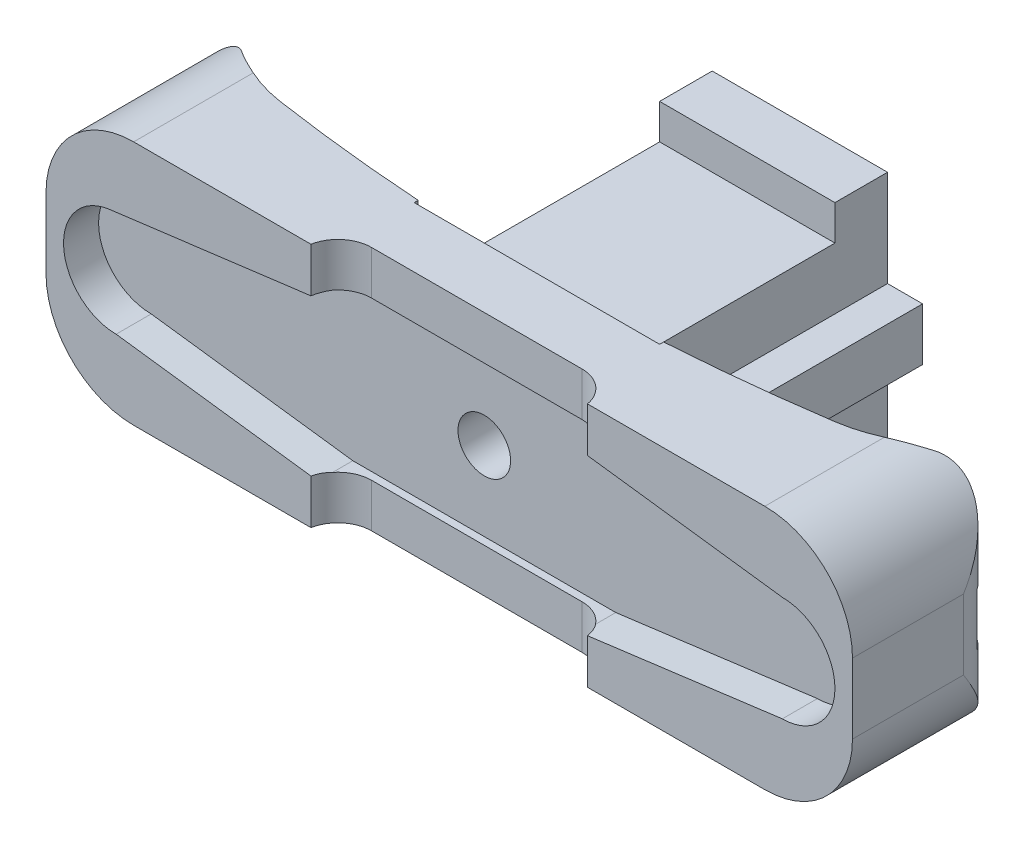
from build123d import *

# Parameters (mm, degrees)
BOSS_EXTRUDE1_DEPTH = 3
BOSS_EXTRUDE2_DEPTH = 2
BOSS_EXTRUDE4_START = 5
BOSS_EXTRUDE4_DEPTH = 5
BOSS_EXTRUDE5_START = -10
BOSS_EXTRUDE5_DEPTH = 10
CUT_EXTRUDE2_DEPTH  = 28.386127875
BOSS_EXTRUDE3_DEPTH = 15
SKETCH9_R           = 1.5
CUT_EXTRUDE3_DEPTH  = 18
SKETCH11_W          = 10
SKETCH11_H          = 3
BOSS_EXTRUDE6_DEPTH = 2
SKETCH12_W          = 6
SKETCH12_H          = 0.35
CUT_EXTRUDE5_DEPTH  = 31.822070135
SKETCH13_R          = 2.25
CUT_EXTRUDE6_DEPTH  = 3
CUT_SWEEP1_START    = -1.5
CUT_SWEEP1_DEPTH    = 3
CUT_EXTRUDE7_DEPTH  = 0.2


# Read off the part's stored shape, not the designer's step: Cut-Sweep1
with BuildPart() as part:
    # Sketch1 → Boss-Extrude1 (new body)
    # profile 1 of 2: a face of its own
    with BuildSketch(Plane.XY):
        with BuildLine():
            Line((7.564942336, -5.5), (19.0695827, -3.999394735))
            ThreePointArc((19.0695827, -3.999394735), (23, 0), (19.0695827, 3.999394735))
            Line((19.0695827, 3.999394735), (7.564942336, 5.5))
            Line((7.564942336, 5.5), (-7.563886473, 5.5))
            Line((-7.563886473, 5.5), (-19.509014255, 3.967480874))
            ThreePointArc((-19.509014255, 3.967480874), (-22.993929187, -0.220294454), (-19.0695827, -3.999394735))
            Line((-19.0695827, -3.999394735), (-7.564942336, -5.5))
            Line((-7.564942336, -5.5), (7.564942336, -5.5))
        make_face()
        with BuildLine():
            Line((-7.5, -4.5), (-19, -3))
            ThreePointArc((-19, -3), (-21.993896455, -0.191269486), (-19.381760691, 2.975610656))
            Line((-19.381760691, 2.975610656), (-7.5, 4.5))
            Line((-7.5, 4.5), (7.5, 4.5))
            Line((7.5, 4.5), (19, 3))
            ThreePointArc((19, 3), (22, 0), (19, -3))
            Line((19, -3), (7.5, -4.5))
            Line((7.5, -4.5), (-7.5, -4.5))
        make_face(mode=Mode.SUBTRACT)
    # profile 2 of 2: a face of its own
    with BuildSketch(Plane.XY):
        with BuildLine():
            ThreePointArc((-19, -3), (-21.993896455, -0.191269486), (-19.381760691, 2.975610656))
            Line((-19.381760691, 2.975610656), (-7.5, 4.5))
            Line((-7.5, 4.5), (7.5, 4.5))
            Line((7.5, 4.5), (19, 3))
            ThreePointArc((19, 3), (22, 0), (19, -3))
            Line((19, -3), (7.5, -4.5))
            Line((7.5, -4.5), (-7.5, -4.5))
            Line((-7.5, -4.5), (-19, -3))
        make_face()
    extrude(amount=BOSS_EXTRUDE1_DEPTH)

    # Sketch2 → Boss-Extrude2 (add)
    with BuildSketch(Plane.XY.offset(3)):
        with BuildLine():
            Line((-7.563886473, 5.5), (-19.509014255, 3.967480874))
            ThreePointArc((-19.509014255, 3.967480874), (-22.993929187, -0.220294454), (-19.0695827, -3.999394735))
            Line((-19.0695827, -3.999394735), (-7.564942336, -5.5))
            Line((-7.564942336, -5.5), (7.564942336, -5.5))
            Line((7.564942336, -5.5), (19.0695827, -3.999394735))
            ThreePointArc((19.0695827, -3.999394735), (23, 0), (19.0695827, 3.999394735))
            Line((19.0695827, 3.999394735), (7.564942336, 5.5))
            Line((7.564942336, 5.5), (-7.563886473, 5.5))
        make_face()
        with BuildLine():
            Line((-7.5, 4.5), (7.5, 4.5))
            Line((7.5, 4.5), (19, 3))
            ThreePointArc((19, 3), (22, 0), (19, -3))
            Line((19, -3), (7.5, -4.5))
            Line((7.5, -4.5), (-7.5, -4.5))
            Line((-7.5, -4.5), (-19, -3))
            ThreePointArc((-19, -3), (-21.993896455, -0.191269486), (-19.381760691, 2.975610656))
            Line((-19.381760691, 2.975610656), (-7.5, 4.5))
        make_face(mode=Mode.SUBTRACT)
    extrude(amount=BOSS_EXTRUDE2_DEPTH)

    # Sketch5 → Boss-Extrude4 (add)
    with BuildSketch(Plane(origin=(0, 0, 0), x_dir=(-1, 0, 0), z_dir=(0, 0, -1)).offset(BOSS_EXTRUDE4_START)):
        with BuildLine():
            Line((-7.564942336, -5.5), (7.564942336, -5.5))
            Line((7.564942336, -5.5), (19.0695827, -3.999394735))
            ThreePointArc((19.0695827, -3.999394735), (22.993929187, -0.220294454), (19.509014255, 3.967480874))
            Line((19.509014255, 3.967480874), (7.563886473, 5.5))
            Line((7.563886473, 5.5), (-7.564942336, 5.5))
            Line((-7.564942336, 5.5), (-19.0695827, 3.999394735))
            ThreePointArc((-19.0695827, 3.999394735), (-23, 0), (-19.0695827, -3.999394735))
            Line((-19.0695827, -3.999394735), (-7.564942336, -5.5))
        make_face()
    extrude(amount=-BOSS_EXTRUDE4_DEPTH)

    # Sketch8 → Boss-Extrude5 (add)
    with BuildSketch(Plane.XY.offset(5).offset(BOSS_EXTRUDE5_START)):
        with BuildLine():
            Line((18, 7), (-18, 7))
            ThreePointArc((-18, 7), (-21.535533906, 5.535533906), (-23, 2))
            Line((-23, 2), (-23, 2.2e-08))
            ThreePointArc((-23, 2.2e-08), (-22.003003241, 2.642342055), (-19.509014255, 3.967480874))
            Line((-19.509014255, 3.967480874), (-7.563886473, 5.5))
            Line((-7.563886473, 5.5), (7.564942336, 5.5))
            Line((7.564942336, 5.5), (19.0695827, 3.999394735))
            ThreePointArc((19.0695827, 3.999394735), (21.852922256, 2.803717996), (23, 0))
            Line((23, 0), (23, 2))
            ThreePointArc((23, 2), (21.535533906, 5.535533906), (18, 7))
        make_face()
        with BuildLine():
            ThreePointArc((-19.0695827, -3.999394735), (-21.852922264, -2.803717988), (-23, 2.2e-08))
            Line((-23, 2.2e-08), (-23, -2))
            ThreePointArc((-23, -2), (-21.535533906, -5.535533906), (-18, -7))
            Line((-18, -7), (18, -7))
            ThreePointArc((18, -7), (21.535533906, -5.535533906), (23, -2))
            Line((23, -2), (23, 0))
            ThreePointArc((23, 0), (21.852922256, -2.803717996), (19.0695827, -3.999394735))
            Line((19.0695827, -3.999394735), (7.564942336, -5.5))
            Line((7.564942336, -5.5), (-7.564942336, -5.5))
            Line((-7.564942336, -5.5), (-19.0695827, -3.999394735))
        make_face()
    extrude(amount=BOSS_EXTRUDE5_DEPTH)

    # Sketch7 → Cut-Extrude2 (cut, through all)
    with BuildSketch(Plane(origin=(0, 7, 0), x_dir=(1, 0, 0), z_dir=(0, 1, 0))):
        with BuildLine():
            Line((-7, 0.22921748), (-7, 0))
            Line((-7, 0), (7, 0))
            Line((7, 0), (7, 0.22921748))
            ThreePointArc((7, 0.22921748), (11.417607011, 0.610911038), (15.815606991, 1.17530262))
            ThreePointArc((15.815606991, 1.17530262), (17.896736032, 1.773676577), (19.750474019, 2.892964277))
            ThreePointArc((19.750474019, 2.892964277), (21.866299036, 3.13397954), (23, 1.331335377))
            Line((23, 1.331335377), (23, 5))
            Line((23, 5), (18, 5))
            Line((18, 5), (-18, 5))
            Line((-18, 5), (-23, 5))
            Line((-23, 5), (-23, 1.331335377))
            ThreePointArc((-23, 1.331335377), (-21.866299036, 3.13397954), (-19.750474019, 2.892964277))
            ThreePointArc((-19.750474019, 2.892964277), (-17.896736032, 1.773676577), (-15.815606991, 1.17530262))
            ThreePointArc((-15.815606991, 1.17530262), (-11.417607011, 0.610911038), (-7, 0.22921748))
        make_face()
    extrude(amount=-CUT_EXTRUDE2_DEPTH, mode=Mode.SUBTRACT)

    # Sketch3 → Boss-Extrude3 (add)
    with BuildSketch(Plane(origin=(0, 0, 0), x_dir=(-1, 0, 0), z_dir=(0, 0, -1))):
        Polygon((-5, -5), (5, -5), (5, -1.5), (7, -1.5), (7, 1.5), (5, 1.5), (5, 5), (-5, 5), (-5, 1.5), (-7, 1.5), (-7, -1.5), (-5, -1.5), align=None)
    extrude(amount=BOSS_EXTRUDE3_DEPTH)

    # Sketch9 → Cut-Extrude3 (cut)
    with BuildSketch(Plane(origin=(0, 0, -15), x_dir=(-1, 0, 0), z_dir=(0, 0, -1))):
        Circle(SKETCH9_R)
    extrude(amount=-CUT_EXTRUDE3_DEPTH, mode=Mode.SUBTRACT)

    # Sketch11 → Boss-Extrude6 (add)
    with BuildSketch(Plane.XZ.offset(5)):
        with Locations((0, -13.5)):
            Rectangle(SKETCH11_W, SKETCH11_H)
    boss_extrude6 = extrude(amount=BOSS_EXTRUDE6_DEPTH)

    # Mirror1: Boss-Extrude6 across plane
    add(boss_extrude6.mirror(Plane.ZX))

    # Sketch12 → Cut-Extrude5 (cut, through all)
    with BuildSketch(Plane(origin=(0, 7, 0), x_dir=(1, 0, 0), z_dir=(0, 1, 0))):
        with BuildLine():
            Line((6, -3.43), (-6, -3.43))
            ThreePointArc((-6, -3.43), (-7.22768074, -3.873788633), (-7.887829441, -5))
            Line((-7.887829441, -5), (-6, -5))
            Line((-6, -5), (0, -5))
            Line((0, -5), (6, -5))
            Line((6, -5), (7.887829441, -5))
            ThreePointArc((7.887829441, -5), (7.22768074, -3.873788633), (6, -3.43))
        make_face()
        with BuildLine():
            ThreePointArc((7.92, -5.35), (7.911940445, -5.174262309), (7.887829441, -5))
            Line((7.887829441, -5), (6, -5))
            Line((6, -5), (6, -5.35))
            Line((6, -5.35), (7.92, -5.35))
        make_face()
        with Locations((3, -5.175)):
            Rectangle(SKETCH12_W, SKETCH12_H)
        with Locations((-3, -5.175)):
            Rectangle(SKETCH12_W, SKETCH12_H)
        with BuildLine():
            Line((-6, -5), (-7.887829441, -5))
            ThreePointArc((-7.887829441, -5), (-7.911940445, -5.174262309), (-7.92, -5.35))
            Line((-7.92, -5.35), (-6, -5.35))
            Line((-6, -5.35), (-6, -5))
        make_face()
    extrude(amount=-CUT_EXTRUDE5_DEPTH, mode=Mode.SUBTRACT)

    # Sketch13 → Cut-Extrude6 (cut)
    with BuildSketch(Plane(origin=(0, 0, -15), x_dir=(-1, 0, 0), z_dir=(0, 0, -1))):
        Circle(SKETCH13_R)
    extrude(amount=-CUT_EXTRUDE6_DEPTH, mode=Mode.SUBTRACT)

    # Cut-Sweep1 outline → Cut-Sweep1 (cut)
    with BuildSketch(Plane(origin=(0, 0, 0), x_dir=(1, 0, 0), z_dir=(0, 1, 0)).offset(CUT_SWEEP1_START)):
        with BuildLine():
            ThreePointArc((19.750474019, 2.892964277), (17.896736032, 1.773676577), (15.815606991, 1.17530262))
            ThreePointArc((15.815606991, 1.17530262), (19.25380245, 1.746538816), (22.671569441, 2.429449944))
            ThreePointArc((22.671569441, 2.429449944), (21.313435089, 3.306622304), (19.750474019, 2.892964277))
        make_face()
        with BuildLine():
            ThreePointArc((-19.750474019, 2.892964277), (-21.313435089, 3.306622304), (-22.671569441, 2.429449944))
            ThreePointArc((-22.671569441, 2.429449944), (-19.25380245, 1.746538816), (-15.815606991, 1.175302621))
            ThreePointArc((-15.815606991, 1.175302621), (-17.896736032, 1.773676577), (-19.750474019, 2.892964277))
        make_face()
    extrude(amount=CUT_SWEEP1_DEPTH, mode=Mode.SUBTRACT)

    # Sketch16 → Cut-Extrude7 (cut)
    with BuildSketch(Plane(origin=(0, 0, -15), x_dir=(-1, 0, 0), z_dir=(0, 0, -1))):
        with BuildLine():
            Line((-0.782178911, -3.34622393), (-1.057018654, -3.556560469))
            add(Edge.make_bspline(
                [(-1.057018654, -3.556560469), (-1.076624543, -3.533194499), (-1.115571989, -3.486777583), (-1.178231192, -3.421598039), (-1.243532835, -3.360532777), (-1.311451956, -3.303290898), (-1.383211076, -3.251874132), (-1.457071874, -3.203603029), (-1.534269919, -3.160335291), (-1.641021654, -3.107872305), (-1.780669502, -3.05312615), (-1.956464341, -3.007222919), (-2.13997544, -2.978001743), (-2.26517304, -2.974836902), (-2.32885359, -2.973227136)],
                knots=[0, 0, 0, 0, 0.757959112, 1.505699292, 2.245454638, 2.979532153, 3.711538275, 4.438200793, 5.171680507, 5.909471876, 7.393775596, 8.890124382, 10.418191784, 12, 12, 12, 12], degree=3))
            add(Edge.make_bspline(
                [(-2.32885359, -2.973227136), (-2.36393689, -2.973631098), (-2.433777882, -2.974435274), (-2.537426356, -2.985044399), (-2.639139407, -2.999955609), (-2.738850873, -3.022080932), (-2.836433831, -3.050053551), (-2.932526234, -3.083478965), (-3.025736833, -3.124833805), (-3.117355072, -3.170542065), (-3.205134283, -3.22216951), (-3.28818933, -3.278482862), (-3.366217298, -3.338851958), (-3.43927991, -3.403503065), (-3.507451859, -3.472145025), (-3.57023917, -3.545509367), (-3.62742458, -3.62336154), (-3.680141605, -3.704674948), (-3.727354338, -3.789212739), (-3.766884218, -3.87728781), (-3.80188934, -3.967391913), (-3.829588582, -4.060543074), (-3.851513099, -4.15608584), (-3.866640763, -4.254276628), (-3.877129234, -4.354910307), (-3.877929411, -4.42311962), (-3.878332757, -4.457501975)],
                knots=[0, 0, 0, 0, 1.054917814, 2.100044995, 3.131103042, 4.146048494, 5.169673617, 6.183595914, 7.203665975, 8.234915748, 9.262203917, 10.264457458, 11.251630812, 12.227803204, 13.197192746, 14.159520551, 15.12972552, 16.100847026, 17.073214652, 18.039054194, 19.002613845, 19.979014051, 20.95965708, 21.949030935, 22.966165397, 24, 24, 24, 24], degree=3))
            add(Edge.make_bspline(
                [(-3.878332757, -4.457501975), (-3.877070938, -4.509233295), (-3.874593524, -4.61080088), (-3.852545189, -4.759571491), (-3.819040098, -4.902092164), (-3.768824521, -5.037472007), (-3.706905471, -5.167380365), (-3.628664859, -5.289619218), (-3.538048322, -5.406035783), (-3.433773902, -5.51387873), (-3.319368086, -5.612392456), (-3.196620175, -5.699143037), (-3.065835887, -5.77145792), (-2.928459257, -5.831633866), (-2.783433143, -5.877890594), (-2.63101834, -5.910454717), (-2.471546345, -5.931696898), (-2.362576945, -5.933730586), (-2.307118815, -5.934765597)],
                knots=[0, 0, 0, 0, 1.029171465, 2.020641659, 2.987623507, 3.938342917, 4.889210282, 5.84687017, 6.821220943, 7.821438502, 8.827599549, 9.822697543, 10.807740252, 11.797342354, 12.80366471, 13.83203677, 14.896651826, 16, 16, 16, 16], degree=3))
            add(Edge.make_bspline(
                [(-2.307118815, -5.934765597), (-2.246016126, -5.933076817), (-2.125751417, -5.929752895), (-1.94938339, -5.901593646), (-1.780547625, -5.855935728), (-1.619235038, -5.792037806), (-1.465900392, -5.708972518), (-1.320303732, -5.60827464), (-1.182322161, -5.488986307), (-1.099350879, -5.397903179), (-1.057018654, -5.351432264)],
                knots=[0, 0, 0, 0, 1.028121516, 2.023589091, 2.998037872, 3.967518031, 4.937445131, 5.927275754, 6.942489185, 8, 8, 8, 8], degree=3))
            Line((-1.057018654, -5.351432264), (-0.782178911, -5.559665437))
            add(Edge.make_bspline(
                [(-0.782178911, -5.559665437), (-0.804297021, -5.588203889), (-0.848427296, -5.645144095), (-0.919885313, -5.725415805), (-0.99516261, -5.80091984), (-1.07481832, -5.871047461), (-1.157936112, -5.937201927), (-1.246008424, -5.997503758), (-1.337877457, -6.052794643), (-1.433231936, -6.103421567), (-1.531970548, -6.148338814), (-1.633974983, -6.186792582), (-1.738805559, -6.219917472), (-1.846467067, -6.247169408), (-1.957182824, -6.268440492), (-2.070553298, -6.282660167), (-2.186823173, -6.292402081), (-2.265264594, -6.293289997), (-2.305015449, -6.293739956)],
                knots=[0, 0, 0, 0, 0.986787822, 1.968848986, 2.935600012, 3.899624008, 4.868462664, 5.837806735, 6.815139263, 7.798259679, 8.787526145, 9.778297419, 10.776456485, 11.791383307, 12.812564526, 13.85620153, 14.913611965, 16, 16, 16, 16], degree=3))
            add(Edge.make_bspline(
                [(-2.305015449, -6.293739956), (-2.342659116, -6.293477964), (-2.417094806, -6.292959906), (-2.526993558, -6.284567738), (-2.633983139, -6.273118001), (-2.737757765, -6.25587787), (-2.83888374, -6.23553353), (-2.936444324, -6.208262274), (-3.031399534, -6.177713107), (-3.123367875, -6.14180812), (-3.212427575, -6.101291938), (-3.298291386, -6.055500379), (-3.380919819, -6.004818514), (-3.46112524, -5.950363504), (-3.537722823, -5.890386202), (-3.611376349, -5.825719567), (-3.682498825, -5.756581557), (-3.72650151, -5.706726703), (-3.748625225, -5.681660629)],
                knots=[0, 0, 0, 0, 1.114604814, 2.203992996, 3.262667896, 4.300477797, 5.318619304, 6.316056647, 7.298880507, 8.271930387, 9.238335007, 10.195173496, 11.151986948, 12.108099108, 13.064862484, 14.031167946, 15.010108607, 16, 16, 16, 16], degree=3))
            add(Edge.make_bspline(
                [(-3.748625225, -5.681660629), (-3.784060868, -5.63811944), (-3.854504345, -5.55156273), (-3.944630029, -5.411276749), (-4.021777584, -5.26480854), (-4.084153505, -5.111388611), (-4.132916238, -4.951361224), (-4.166697433, -4.784645709), (-4.188649037, -4.611397767), (-4.191159326, -4.493560978), (-4.192435321, -4.433663834)],
                knots=[0, 0, 0, 0, 0.994628077, 1.977248131, 2.950237994, 3.925870899, 4.908910175, 5.911660606, 6.938484602, 8, 8, 8, 8], degree=3))
            add(Edge.make_bspline(
                [(-4.192435321, -4.433663834), (-4.190880127, -4.370708381), (-4.187820381, -4.246847456), (-4.161824586, -4.065073503), (-4.120005789, -3.890922104), (-4.060608901, -3.724718359), (-3.98530355, -3.565588079), (-3.892276936, -3.414746874), (-3.782609794, -3.271230075), (-3.657162226, -3.137215323), (-3.519594891, -3.014675971), (-3.372276077, -2.906869767), (-3.21549413, -2.817152251), (-3.050976278, -2.742156089), (-2.877490596, -2.684511625), (-2.695407227, -2.644158439), (-2.505068313, -2.619041323), (-2.375205887, -2.615866115), (-2.30922218, -2.614252777)],
                knots=[0, 0, 0, 0, 1.032925535, 2.032216505, 3.007276963, 3.968222605, 4.92396291, 5.891752235, 6.871517503, 7.883894988, 8.900124299, 9.891468569, 10.874487609, 11.85992873, 12.854644235, 13.869047385, 14.917252991, 16, 16, 16, 16], degree=3))
            add(Edge.make_bspline(
                [(-2.30922218, -2.614252777), (-2.269007708, -2.614734915), (-2.189407211, -2.615689259), (-2.071654558, -2.624995401), (-1.957012231, -2.640509007), (-1.845401249, -2.661625077), (-1.736278633, -2.687832398), (-1.630478392, -2.721972697), (-1.527379705, -2.761009228), (-1.427632797, -2.805967694), (-1.331716247, -2.856434435), (-1.239659929, -2.911850059), (-1.15219507, -2.972145864), (-1.068706221, -3.03680904), (-0.99059001, -3.107207599), (-0.915628532, -3.181405195), (-0.846367454, -3.261539019), (-0.803614259, -3.317943953), (-0.782178911, -3.34622393)],
                knots=[0, 0, 0, 0, 1.096760587, 2.17092713, 3.219439832, 4.250915756, 5.268269357, 6.278326846, 7.281116186, 8.274029601, 9.260640565, 10.235837813, 11.203064059, 12.156899882, 13.114053108, 14.069676657, 15.032185724, 16, 16, 16, 16], degree=3))
        make_face()
        with BuildLine():
            add(Edge.make_bspline(
                [(0.182564679, -5.665534828), (0.202054891, -5.666692995), (0.240263174, -5.668963445), (0.295502302, -5.684540119), (0.345496962, -5.712198779), (0.390029206, -5.749061558), (0.426735683, -5.793757221), (0.455380035, -5.843353129), (0.47082102, -5.899054722), (0.473074932, -5.937484397), (0.474231346, -5.957201495)],
                knots=[0, 0, 0, 0, 1.020151414, 1.999887582, 2.974338812, 3.990962822, 5.007586832, 5.987933904, 6.967670073, 8, 8, 8, 8], degree=3))
            add(Edge.make_bspline(
                [(0.474231346, -5.957201495), (0.473035745, -5.976444824), (0.470678038, -6.014392388), (0.45541543, -6.069673851), (0.42651738, -6.119300755), (0.390282387, -6.164602893), (0.345485953, -6.201543764), (0.295384107, -6.228967109), (0.240392848, -6.245659088), (0.202076525, -6.247785386), (0.182564679, -6.248868161)],
                knots=[0, 0, 0, 0, 1.009421747, 1.99056486, 2.972319754, 3.999869655, 5.017953583, 5.993804169, 6.978383603, 8, 8, 8, 8], degree=3))
            add(Edge.make_bspline(
                [(0.182564679, -6.248868161), (0.163038773, -6.247824564), (0.124919091, -6.245787189), (0.070133097, -6.228624383), (0.019726128, -6.201800922), (-0.025061584, -6.164534013), (-0.061600055, -6.11953387), (-0.089225438, -6.069332073), (-0.105815587, -6.014550636), (-0.10799746, -5.976475993), (-0.109101988, -5.957201495)],
                knots=[0, 0, 0, 0, 1.022052826, 1.995314843, 2.982371812, 4.00089066, 5.028879526, 6.005146991, 6.990147033, 8, 8, 8, 8], degree=3))
            add(Edge.make_bspline(
                [(-0.109101988, -5.957201495), (-0.108039888, -5.937452115), (-0.10596627, -5.898893875), (-0.08919061, -5.843694767), (-0.061814398, -5.793526328), (-0.024809003, -5.749129748), (0.019715293, -5.711942445), (0.070011498, -5.684877652), (0.125051039, -5.66883724), (0.163060977, -5.666654723), (0.182564679, -5.665534828)],
                knots=[0, 0, 0, 0, 1.032775665, 2.016367738, 2.991239715, 4.008302682, 5.025365648, 6.011011707, 6.979408107, 8, 8, 8, 8], degree=3))
        make_face()
        Polygon((1.666839519, -2.703996366), (2.313974935, -2.703996366), (2.313974935, -6.203996366), (1.999872371, -6.203996366), (1.999872371, -3.062970725), (1.461410833, -3.062970725), align=None)
    extrude(amount=-CUT_EXTRUDE7_DEPTH, mode=Mode.SUBTRACT)


solid = part.part
